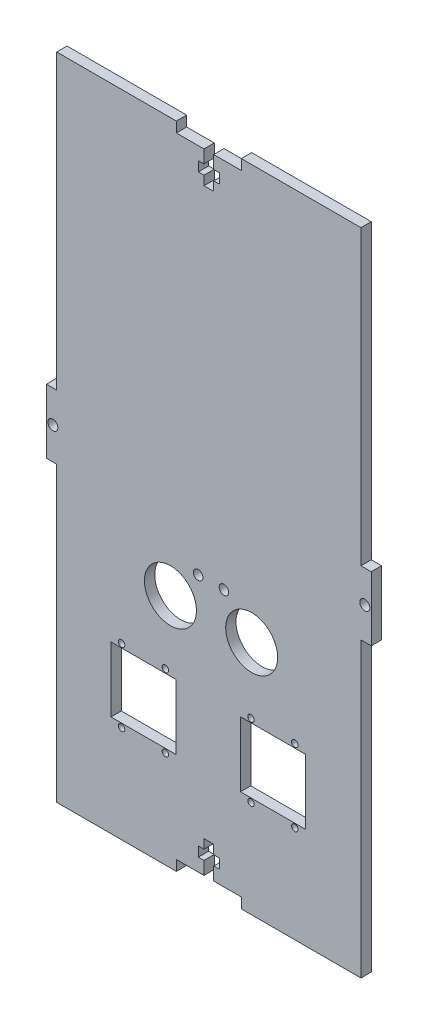
from build123d import *

# Parameters (mm, degrees)
SKETCH1_W           = 100
SKETCH1_H           = 200
BOSS_EXTRUDE2_DEPTH = 3.18
SKETCH2_R           = 1.55
SKETCH2_W           = 3.18
SKETCH2_H           = 90.125
CUT_EXTRUDE1_DEPTH  = 112.84861376
SKETCH4_R           = 1
CUT_EXTRUDE15_DEPTH = 10
SKETCH5_R           = 8
CUT_EXTRUDE16_DEPTH = 112.84861376
SKETCH6_R           = 1.47
CUT_EXTRUDE17_DEPTH = 112.84861376
SKETCH7_W           = 20
SKETCH7_H           = 20
CUT_EXTRUDE18_DEPTH = 112.84861376


with BuildPart() as part:
    # Sketch1 → Boss-Extrude2 (new body)
    with BuildSketch(Plane.XY):
        Rectangle(SKETCH1_W, SKETCH1_H)
    extrude(amount=BOSS_EXTRUDE2_DEPTH)

    # Sketch2 → Cut-Extrude1 (cut, through all)
    with BuildSketch(Plane.XY.offset(3.18)):
        with Locations((-48, 0)):
            Circle(SKETCH2_R)
        Polygon((-10, 100), (-10, 96.82), (-1.5, 96.82), (-1.5, 92.82), (-3.25, 92.82), (-3.25, 89.82), (-1.5, 89.82), (-1.5, 87), (1.5, 87), (1.5, 89.82), (3.25, 89.82), (3.25, 92.82), (1.5, 92.82), (1.5, 96.82), (10, 96.82), (10, 100), align=None)
        with Locations((-48.41, 54.9375)):
            Rectangle(SKETCH2_W, SKETCH2_H)
        with Locations((-48.41, -54.9375)):
            Rectangle(SKETCH2_W, SKETCH2_H)
    cut_extrude1 = extrude(amount=-CUT_EXTRUDE1_DEPTH, mode=Mode.SUBTRACT)

    # Mirror1: Cut-Extrude1 across plane
    add(cut_extrude1.mirror(Plane.ZX), mode=Mode.SUBTRACT)

    # Mirror3: Cut-Extrude1 across plane
    add(cut_extrude1.mirror(Plane(origin=(0, 0, 0), x_dir=(0, 0, 1), z_dir=(1, 0, 0))), mode=Mode.SUBTRACT)

    # Sketch4 → Cut-Extrude15 (cut)
    with BuildSketch(Plane(origin=(0, 0, 0), x_dir=(-1, 0, 0), z_dir=(0, 0, -1))):
        with Locations((13.361708712, -70.119061845)):
            Circle(SKETCH4_R)
        with Locations((26.861708712, -70.119061845)):
            Circle(SKETCH4_R)
        with Locations((26.861708712, -47.659061845)):
            Circle(SKETCH4_R)
        with Locations((13.361708712, -47.659061845)):
            Circle(SKETCH4_R)
        with Locations((-12.978894748, -47.682446814)):
            Circle(SKETCH4_R)
        with Locations((-26.478894748, -47.682446814)):
            Circle(SKETCH4_R)
        with Locations((-26.478894748, -70.142446814)):
            Circle(SKETCH4_R)
        with Locations((-12.978894748, -70.142446814)):
            Circle(SKETCH4_R)
    extrude(amount=-CUT_EXTRUDE15_DEPTH, mode=Mode.SUBTRACT)

    # Sketch5 → Cut-Extrude16 (cut, through all)
    with BuildSketch(Plane(origin=(0, 0, 0), x_dir=(-1, 0, 0), z_dir=(0, 0, -1))):
        with Locations((11.82, -27.421398987)):
            Circle(SKETCH5_R)
        with Locations((-13.18, -27.421398987)):
            Circle(SKETCH5_R)
    extrude(amount=-CUT_EXTRUDE16_DEPTH, mode=Mode.SUBTRACT)

    # Sketch6 → Cut-Extrude17 (cut, through all)
    with BuildSketch(Plane(origin=(0, 0, 0), x_dir=(-1, 0, 0), z_dir=(0, 0, -1))):
        with Locations((3.283505193, -17.616897143)):
            Circle(SKETCH6_R)
        with Locations((-4.643505193, -17.616897143)):
            Circle(SKETCH6_R)
    extrude(amount=-CUT_EXTRUDE17_DEPTH, mode=Mode.SUBTRACT)

    # Sketch7 → Cut-Extrude18 (cut, through all)
    with BuildSketch(Plane(origin=(0, 0, 0), x_dir=(-1, 0, 0), z_dir=(0, 0, -1))):
        with Locations((20.111708712, -58.889061845)):
            Rectangle(SKETCH7_W, SKETCH7_H)
        with Locations((-19.728894748, -58.912446814)):
            Rectangle(SKETCH7_W, SKETCH7_H)
    extrude(amount=-CUT_EXTRUDE18_DEPTH, mode=Mode.SUBTRACT)


solid = part.part
